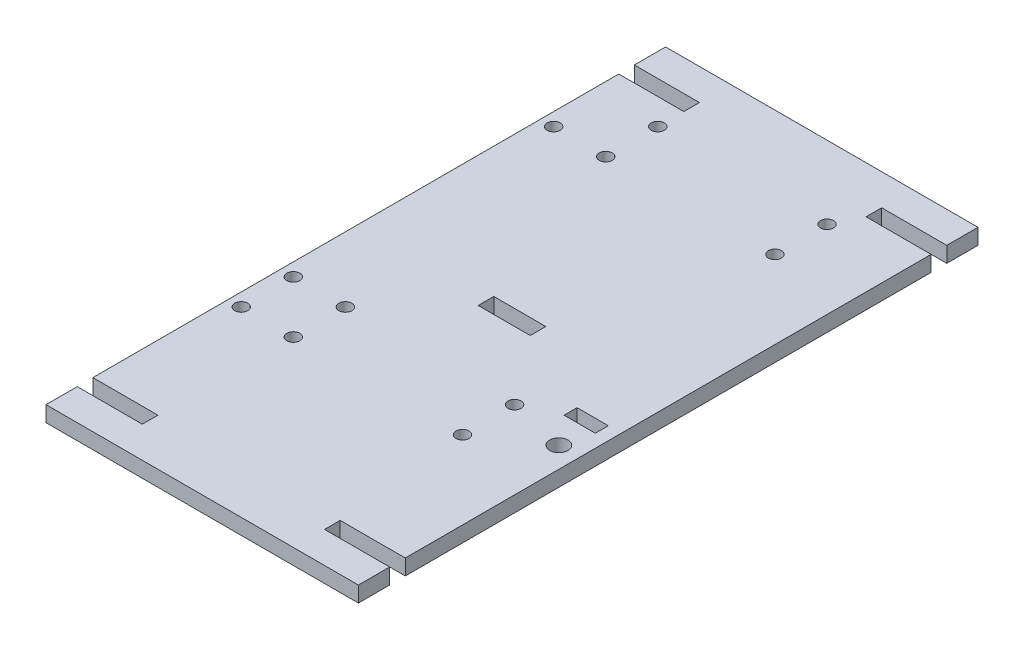
from build123d import *

# Parameters (mm, degrees)
SKETCH1_W            = 120
SKETCH1_H            = 238
BOSS_EXTRUDE1_DEPTH  = 6
SKETCH2_W            = 25
SKETCH2_H            = 6
CUT_EXTRUDE1_DEPTH   = 267.608326952
LPATTERN1_COUNT      = 2
LPATTERN1_PITCH      = 208
LPATTERN1_COUNT_DIR2 = 2
LPATTERN1_PITCH_DIR2 = 95
SKETCH3_W            = 20
SKETCH3_H            = 6
CUT_EXTRUDE2_DEPTH   = 10
SKETCH4_R            = 2.5
CUT_EXTRUDE4_DEPTH   = 10
SKETCH6_R            = 3.5
SKETCH6_W            = 12
SKETCH6_H            = 5
CUT_EXTRUDE5_DEPTH   = 10


with BuildPart() as part:
    # Sketch1 → Boss-Extrude1 (new body)
    with BuildSketch(Plane(origin=(0, 0, 0), x_dir=(1, 0, 0), z_dir=(0, 1, 0))):
        with Locations((-60, 119)):
            Rectangle(SKETCH1_W, SKETCH1_H)
    extrude(amount=BOSS_EXTRUDE1_DEPTH)

    # Sketch2 → Cut-Extrude1 (cut, through all)
    with BuildSketch(Plane(origin=(0, 6, 0), x_dir=(1, 0, 0), z_dir=(0, 1, 0))):
        with Locations((-107.5, 223)):
            Rectangle(SKETCH2_W, SKETCH2_H)
    cut_extrude1 = extrude(amount=-CUT_EXTRUDE1_DEPTH, mode=Mode.SUBTRACT)

    # LPattern1: Cut-Extrude1 2 × 2
    with Locations(*[(j * LPATTERN1_PITCH_DIR2, 0, i * LPATTERN1_PITCH) for i in range(LPATTERN1_COUNT) for j in range(LPATTERN1_COUNT_DIR2) if (i, j) != (0, 0)]):
        add(cut_extrude1, mode=Mode.SUBTRACT)

    # Sketch3 → Cut-Extrude2 (cut)
    with BuildSketch(Plane(origin=(0, 6, 0), x_dir=(1, 0, 0), z_dir=(0, 1, 0))):
        with Locations((-60, 119)):
            Rectangle(SKETCH3_W, SKETCH3_H)
    extrude(amount=-CUT_EXTRUDE2_DEPTH, mode=Mode.SUBTRACT)

    # Sketch4 → Cut-Extrude4 (cut)
    with BuildSketch(Plane(origin=(0, 6, 0), x_dir=(1, 0, 0), z_dir=(0, 1, 0))):
        with Locations((-30, 210)):
            Circle(SKETCH4_R)
        with Locations((-30, 190)):
            Circle(SKETCH4_R)
        with Locations((-95, 210)):
            Circle(SKETCH4_R)
        with Locations((-95, 190)):
            Circle(SKETCH4_R)
        with Locations((-115, 190)):
            Circle(SKETCH4_R)
        with Locations((-95, 90)):
            Circle(SKETCH4_R)
        with Locations((-115, 90)):
            Circle(SKETCH4_R)
        with Locations((-95, 70)):
            Circle(SKETCH4_R)
        with Locations((-30, 90)):
            Circle(SKETCH4_R)
        with Locations((-30, 70)):
            Circle(SKETCH4_R)
        with Locations((-115, 70)):
            Circle(SKETCH4_R)
    extrude(amount=-CUT_EXTRUDE4_DEPTH, mode=Mode.SUBTRACT)

    # Sketch6 → Cut-Extrude5 (cut)
    with BuildSketch(Plane(origin=(0, 6, 0), x_dir=(1, 0, 0), z_dir=(0, 1, 0))):
        with Locations((-8, 85)):
            Circle(SKETCH6_R)
        with Locations((-11, 98.5)):
            Rectangle(SKETCH6_W, SKETCH6_H)
    extrude(amount=-CUT_EXTRUDE5_DEPTH, mode=Mode.SUBTRACT)


solid = part.part
